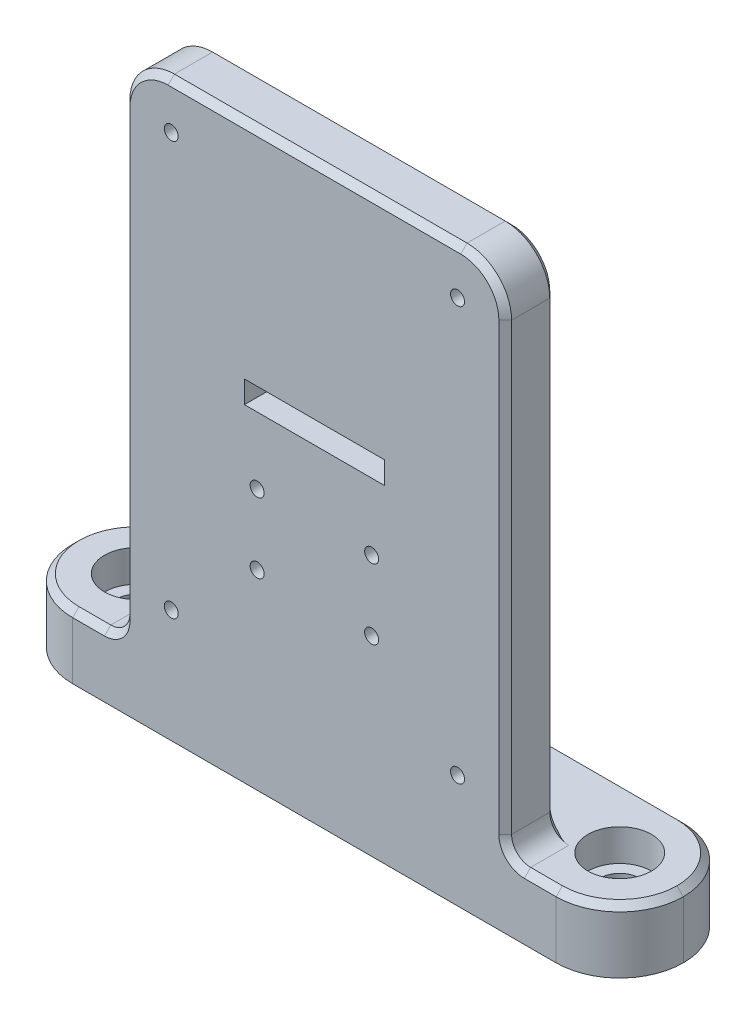
from build123d import *

# Parameters (mm, degrees)
SKETCH_1_W          = 96
SKETCH_1_H          = 20
EXTRUDE_1_DEPTH     = 10
SKETCH_2_R          = 5
CUT_EXTRUDE_1_DEPTH = 5
FILLET_1_R          = 10
SKETCH_3_R          = 3.1
CUT_EXTRUDE_2_DEPTH = 5
CHAMFER_1_SIZE      = 1
SKETCH_4_W          = 60
SKETCH_4_H          = 20
EXTRUDE_2_DEPTH     = 80
CUT_EXTRUDE_4_REACH = 105.942
SKETCH_6_R          = 1.1
CUT_EXTRUDE_5_DEPTH = 11
SKETCH_8_W          = 60
SKETCH_8_H          = 102
CUT_EXTRUDE_6_DEPTH = 12
SKETCH_9_R          = 1.1
CUT_EXTRUDE_7_DEPTH = 10
FILLET_8_R          = 7
SKETCH_10_W         = 12
SKETCH_10_H         = 10
EXTRUDE_3_DEPTH     = 60
FILLET_11_R         = 3
CHAMFER_4_SIZE      = 1


with BuildPart() as part:
    # 草图1 → 凸台-拉伸1 (new body)
    with BuildSketch(Plane(origin=(0, 0, 0), x_dir=(1, 0, 0), z_dir=(0, 1, 0))):
        Rectangle(SKETCH_1_W, SKETCH_1_H)
    extrude(amount=EXTRUDE_1_DEPTH)

    # 草图2 → 切除-拉伸1 (cut)
    with BuildSketch(Plane(origin=(0, 10, 0), x_dir=(1, 0, 0), z_dir=(0, 1, 0))):
        with Locations(Location((-38, 0, 0), (0, 0, 270))):
            Circle(SKETCH_2_R)
        with Locations(Location((38, 0, 0), (0, 0, 90))):
            Circle(SKETCH_2_R)
    extrude(amount=-CUT_EXTRUDE_1_DEPTH, mode=Mode.SUBTRACT)

    # 圆角1
    fillet_1_edges = [part.edges().sort_by_distance(p)[0] for p in [
        (48, 5, -10),
        (48, 5, 10),
        (-48, 5, 10),
        (-48, 5, -10),
    ]]
    fillet(fillet_1_edges, radius=FILLET_1_R - 0.0001)  # a hair under: the kernel refuses the full size

    # 草图3 → 切除-拉伸2 (cut)
    with BuildSketch(Plane(origin=(0, 5, 0), x_dir=(1, 0, 0), z_dir=(0, 1, 0))):
        with Locations(Location((-38, 0, 0), (0, 0, 270))):
            Circle(SKETCH_3_R)
        with Locations(Location((38, 0, 0), (0, 0, 270))):
            Circle(SKETCH_3_R)
    extrude(amount=-CUT_EXTRUDE_2_DEPTH, mode=Mode.SUBTRACT)

    # 倒角1
    chamfer_1_edges = [part.edges().sort_by_distance(p)[0] for p in [
        (-38, 0, -3.1),
        (38, 0, -3.1),
    ]]
    chamfer(chamfer_1_edges, length=CHAMFER_1_SIZE)

    # 草图4 → 凸台-拉伸2 (add)
    with BuildSketch(Plane(origin=(0, 10, 0), x_dir=(1, 0, 0), z_dir=(0, 1, 0))):
        Rectangle(SKETCH_4_W, SKETCH_4_H)
    extrude(amount=EXTRUDE_2_DEPTH)

    # 草图6 → 切除-拉伸4 (cut, up to next)
    with BuildSketch(Plane.XY.offset(10), mode=Mode.PRIVATE) as cut_extrude_4_sk1:
        with Locations((-9, 41)):
            Circle(SKETCH_6_R)
    cut_extrude_4_tool1 = extrude(cut_extrude_4_sk1.sketch, amount=-CUT_EXTRUDE_4_REACH, mode=Mode.PRIVATE) & part.part
    # 草图6 → 切除-拉伸4 (cut, up to next)
    with BuildSketch(Plane.XY.offset(10), mode=Mode.PRIVATE) as cut_extrude_4_sk2:
        with Locations((9, 41)):
            Circle(SKETCH_6_R)
    cut_extrude_4_tool2 = extrude(cut_extrude_4_sk2.sketch, amount=-CUT_EXTRUDE_4_REACH, mode=Mode.PRIVATE) & part.part
    # 草图6 → 切除-拉伸4 (cut, up to next)
    with BuildSketch(Plane.XY.offset(10), mode=Mode.PRIVATE) as cut_extrude_4_sk3:
        with Locations((9, 30)):
            Circle(SKETCH_6_R)
    cut_extrude_4_tool3 = extrude(cut_extrude_4_sk3.sketch, amount=-CUT_EXTRUDE_4_REACH, mode=Mode.PRIVATE) & part.part
    # 草图6 → 切除-拉伸4 (cut, up to next)
    with BuildSketch(Plane.XY.offset(10), mode=Mode.PRIVATE) as cut_extrude_4_sk4:
        with Locations((-9, 30)):
            Circle(SKETCH_6_R)
    cut_extrude_4_tool4 = extrude(cut_extrude_4_sk4.sketch, amount=-CUT_EXTRUDE_4_REACH, mode=Mode.PRIVATE) & part.part
    add(cut_extrude_4_tool1.solids().sort_by_distance((-9, 41, 10))[0], mode=Mode.SUBTRACT)
    add(cut_extrude_4_tool2.solids().sort_by_distance((9, 41, 10))[0], mode=Mode.SUBTRACT)
    add(cut_extrude_4_tool3.solids().sort_by_distance((9, 30, 10))[0], mode=Mode.SUBTRACT)
    add(cut_extrude_4_tool4.solids().sort_by_distance((-9, 30, 10))[0], mode=Mode.SUBTRACT)

    # 草图6<8> → 切除-拉伸5 (cut)
    with BuildSketch(Plane.XY.offset(10)):
        Polygon((0, 55), (11, 55), (11, 51.5), (-11, 51.5), (-11, 55), align=None)
    extrude(amount=-CUT_EXTRUDE_5_DEPTH, mode=Mode.SUBTRACT)

    # 草图8 → 切除-拉伸6 (cut)
    with BuildSketch(Plane(origin=(0, 0, -10), x_dir=(-1, 0, 0), z_dir=(0, 0, -1))):
        with Locations((0, 39)):
            Rectangle(SKETCH_8_W, SKETCH_8_H)
    extrude(amount=-CUT_EXTRUDE_6_DEPTH, mode=Mode.SUBTRACT)

    # 草图9 → 切除-拉伸7 (cut)
    with BuildSketch(Plane(origin=(0, 0, 2), x_dir=(-1, 0, 0), z_dir=(0, 0, -1))):
        with Locations((-22.5, 82.797945994)):
            Circle(SKETCH_9_R)
        with Locations((22.5, 82.797945994)):
            Circle(SKETCH_9_R)
        with Locations((22.5, 17.797945994)):
            Circle(SKETCH_9_R)
        with Locations((-22.5, 17.797945994)):
            Circle(SKETCH_9_R)
    extrude(amount=-CUT_EXTRUDE_7_DEPTH, mode=Mode.SUBTRACT)

    # 圆角8
    fillet_8_edges = [part.edges().sort_by_distance(p)[0] for p in [
        (-30, 90, 6),
        (30, 90, 6),
    ]]
    fillet(fillet_8_edges, radius=FILLET_8_R)

    # 草图10 → 凸台-拉伸3 (add)
    with BuildSketch(Plane.ZY.offset(-30)):
        with Locations((-4, 5)):
            Rectangle(SKETCH_10_W, SKETCH_10_H)
    extrude(amount=EXTRUDE_3_DEPTH)

    # 圆角11
    fillet_11_edges = [part.edges().sort_by_distance(p)[0] for p in [
        (-30, 10, 6),
        (30, 10, 6),
    ]]
    fillet(fillet_11_edges, radius=FILLET_11_R)

    # 倒角4
    chamfer_4_edges = [part.edges().sort_by_distance(p)[0] for p in [
        (0, 90, 2),
        (0, 90, 10),
        (30, 48, 10),
        (-30, 48, 10),
        (27.949747468, 87.949747468, 10),
        (-27.949747468, 87.949747468, 10),
        (30, 48, 2),
        (27.949747468, 87.949747468, 2),
        (-27.949747468, 87.949747468, 2),
        (-30, 48, 2),
        (35.50005, 10, 10),
        (-30.878679656, 10.878679656, 10),
        (-30.878679656, 10.878679656, 2),
        (30.878679656, 10.878679656, 2),
        (30.878679656, 10.878679656, 10),
        (0, 10, -10),
        (-35.50005, 10, 10),
        (-45.071097101, 10, -7.071097101),
        (-45.071097101, 10, 7.071097101),
        (45.071097101, 10, 7.071097101),
        (45.071097101, 10, -7.071097101),
    ]]
    chamfer(chamfer_4_edges, length=CHAMFER_4_SIZE)


solid = part.part
